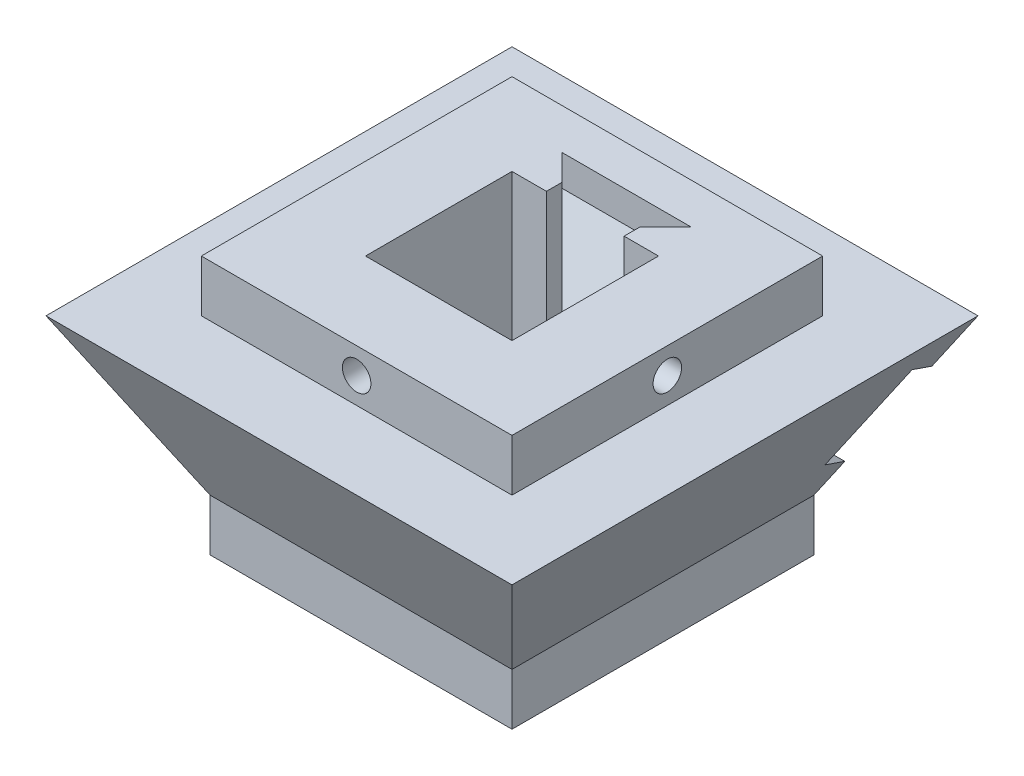
from build123d import *

# Parameters (mm, degrees)
SKETCH1_W                = 58.3
SKETCH1_H                = 58.3
SKETCH1_W_2              = 28.3
SKETCH1_H_2              = 28.3
BOSS_EXTRUDE1_DEPTH      = 10
SKETCH4_W                = 60
SKETCH4_H                = 60
BOSS_EXTRUDE2_DEPTH      = 10
SKETCH6_W                = 60
SKETCH6_H                = 26.8
ESP32_DEPTH              = 6
SKETCH8_W                = 28.3
SKETCH8_H                = 28.3
CUT_EXTRUDE3_DEPTH       = 48
SKETCH10_W               = 30
SKETCH10_H               = 5
CUT_EXTRUDE5_DEPTH       = 50
CUT_EXTRUDE2_REACH       = 95.195
SKETCH7_W                = 50
SKETCH7_H                = 3.2
CUT_EXTRUDE6_START       = -10
CUT_EXTRUDE6_DEPTH       = 71.932070392
CUT_EXTRUDE7_START       = -25
CUT_EXTRUDE7_DEPTH       = 50
CUT_EXTRUDE8_REACH       = 102.747
SKETCH14_W               = 15
SKETCH14_H               = 3
CUT_EXTRUDE9_DEPTH       = 48
CHAMFER1_SIZE            = 7.5
CUT_EXTRUDE10_REACH      = 81.712
SKETCH15_R               = 2.65
SKETCH16_W               = 15.4
SKETCH16_H               = 16.6
CANBUS_DEPTH             = 3
SKETCH18_R               = 1.35
M2_CANBUS_HEAT_SET_DEPTH = 6
SKETCH19_R               = 2.75
CUT_EXTRUDE13_DEPTH      = 8
SKETCH20_R               = 2.75
CUT_EXTRUDE14_DEPTH      = 8
SKETCH21_R               = 2.75
CUT_EXTRUDE15_DEPTH      = 8
CUT_EXTRUDE16_START      = -8
SKETCH22_R               = 2.75
CUT_EXTRUDE16_DEPTH      = 8


# Read off the part's stored shape, not the designer's step: Cut-Extrude7
with BuildPart() as part:
    # Sketch1 → Boss-Extrude1 (new body)
    # profile 1 of 2: a face of its own
    with BuildSketch(Plane(origin=(0, 0, 0), x_dir=(1, 0, 0), z_dir=(0, 1, 0))):
        Rectangle(SKETCH1_W, SKETCH1_H)
        Rectangle(SKETCH1_W_2, SKETCH1_H_2, mode=Mode.SUBTRACT)
    # profile 2 of 2: a face of its own
    with BuildSketch(Plane(origin=(0, 0, 0), x_dir=(1, 0, 0), z_dir=(0, 1, 0))):
        Rectangle(SKETCH1_W_2, SKETCH1_H_2)
    extrude(amount=BOSS_EXTRUDE1_DEPTH)

    # Sketch2 → section 1 of loft1
    with BuildSketch(Plane(origin=(0, 40, 0), x_dir=(1, 0, 0), z_dir=(0, 1, 0)), mode=Mode.PRIVATE) as loft1_s1:
        with BuildLine():
            Line((-45, -45), (45, -45))
            Line((45, -45), (45, 45))
            Line((45, 45), (-45, 45))
            Line((-45, 45), (-45, -45))
        make_face()
    # loft from a face of the part (loft1)
    loft([part.faces().sort_by_distance((0, 10, 0))[0], loft1_s1.sketch])

    # Sketch4 → Boss-Extrude2 (add)
    with BuildSketch(Plane(origin=(0, 40, 0), x_dir=(1, 0, 0), z_dir=(0, 1, 0))):
        Rectangle(SKETCH4_W, SKETCH4_H)
    extrude(amount=BOSS_EXTRUDE2_DEPTH)

    # Sketch6 → ESP32 (cut)
    with BuildSketch(Plane(origin=(0, -9.857868483, -18.658426151), x_dir=(-1, 0, 0), z_dir=(0, -0.4671427704257183, -0.8841818998594039))):
        with Locations((0, 37.859030757)):
            Rectangle(SKETCH6_W, SKETCH6_H)
    extrude(amount=-ESP32_DEPTH, mode=Mode.SUBTRACT)

    # Sketch8 → Cut-Extrude3 (cut)
    with BuildSketch(Plane(origin=(0, 50, 0), x_dir=(1, 0, 0), z_dir=(0, 1, 0))):
        Rectangle(SKETCH8_W, SKETCH8_H)
    extrude(amount=-CUT_EXTRUDE3_DEPTH, mode=Mode.SUBTRACT)

    # Sketch10 → Cut-Extrude5 (cut)
    with BuildSketch(Plane(origin=(0, 0, 0), x_dir=(-1, 0, 0), z_dir=(0, -1, 0))):
        with Locations((0, 19.65)):
            Rectangle(SKETCH10_W, SKETCH10_H)
    extrude(amount=-CUT_EXTRUDE5_DEPTH, mode=Mode.SUBTRACT)

    # Cut-Extrude2: up to this plane
    cut_extrude2_end = Plane(origin=(-15, 50, -22.15), z_dir=(0, 0, -1))
    # Sketch7 → Cut-Extrude2 (cut, up to the surface)
    with BuildSketch(Plane(origin=(0, -7.055011861, -13.353334752), x_dir=(-1, 0, 0), z_dir=(0, -0.46714277042571845, -0.8841818998594037)), mode=Mode.PRIVATE) as cut_extrude2_sk1:
        with Locations((0, 47.659030757)):
            Rectangle(SKETCH7_W, SKETCH7_H)
    cut_extrude2_tool1 = split(extrude(cut_extrude2_sk1.sketch, amount=-CUT_EXTRUDE2_REACH, mode=Mode.PRIVATE), bisect_by=cut_extrude2_end, keep=Keep.BOTH, mode=Mode.PRIVATE)
    add(cut_extrude2_tool1.solids().sort_by_distance((0, 35.08424, -35.616906))[0], mode=Mode.SUBTRACT)
    # Sketch7 → Cut-Extrude2 (cut, up to the surface)
    with BuildSketch(Plane(origin=(0, -7.055011861, -13.353334752), x_dir=(-1, 0, 0), z_dir=(0, -0.46714277042571845, -0.8841818998594037)), mode=Mode.PRIVATE) as cut_extrude2_sk2:
        with Locations((0, 28.059030757)):
            Rectangle(SKETCH7_W, SKETCH7_H)
    cut_extrude2_tool2 = split(extrude(cut_extrude2_sk2.sketch, amount=-CUT_EXTRUDE2_REACH, mode=Mode.PRIVATE), bisect_by=cut_extrude2_end, keep=Keep.BOTH, mode=Mode.PRIVATE)
    add(cut_extrude2_tool2.solids().sort_by_distance((0, 17.754275, -26.460908))[0], mode=Mode.SUBTRACT)

    # Sketch11 → Cut-Extrude6 (cut, through all)
    with BuildSketch(Plane(origin=(0, 50, 0), x_dir=(1, 0, 0), z_dir=(0, 1, 0)).offset(CUT_EXTRUDE6_START)):
        Polygon((-25, 22.15), (25, 22.15), (15, 17.15), (-15, 17.15), align=None)
    extrude(amount=-CUT_EXTRUDE6_DEPTH, mode=Mode.SUBTRACT)

    # Cut-Extrude7 outline → Cut-Extrude7 (cut)
    with BuildSketch(Plane.YZ.offset(CUT_EXTRUDE7_START)):
        Polygon((40.38967366, -22.15), (21.841454111, -22.15), (21.504680154, -22.787427049), (36.005263311, -30.448568484), align=None)
    extrude(amount=CUT_EXTRUDE7_DEPTH, mode=Mode.SUBTRACT)

    # Cut-Extrude8: up to this plane
    cut_extrude8_end = Plane(origin=(18.658426151, -9.857868483, 0), z_dir=(-0.884181899859404, 0.4671427704257181, 0))
    # Sketch13 → Cut-Extrude8 (cut, up to the surface)
    with BuildSketch(Plane.ZY.offset(-30), mode=Mode.PRIVATE) as cut_extrude8_sk1:
        Polygon((-32.139713731, 15.658764159), (-40.548283598, 31.574038357), (-35.243192199, 34.376894979), (-26.834622332, 18.461620782), align=None)
    cut_extrude8_tool1 = split(extrude(cut_extrude8_sk1.sketch, amount=-CUT_EXTRUDE8_REACH, mode=Mode.PRIVATE), bisect_by=cut_extrude8_end, keep=Keep.BOTH, mode=Mode.PRIVATE)
    add(cut_extrude8_tool1.solids().sort_by_distance((30, 25.01783, -33.691453))[0], mode=Mode.SUBTRACT)

    # Sketch14 → Cut-Extrude9 (cut)
    with BuildSketch(Plane(origin=(0, 50, 0), x_dir=(1, 0, 0), z_dir=(0, 1, 0))):
        with Locations((0, 15.65)):
            Rectangle(SKETCH14_W, SKETCH14_H)
    extrude(amount=-CUT_EXTRUDE9_DEPTH, mode=Mode.SUBTRACT)

    # Chamfer1
    # the kernel refuses this chamfer: 7.5 mm, written as the material it adds along each edge
    with BuildSketch(Plane(origin=(15, 40, -17.15), x_dir=(-0.9996219169112968, 0, 0.02749587661058632), z_dir=(0, 1, 0))) as chamfer1_piece_1_section:
        Polygon((CHAMFER1_SIZE * 0.999621916911, -CHAMFER1_SIZE * 0.0274958766106), (-CHAMFER1_SIZE * 0.0274958766106, -CHAMFER1_SIZE * 0.999621916911), (0, 0), align=None)
    chamfer1_piece_1 = extrude(amount=10, mode=Mode.PRIVATE)
    chamfer1_piece_1 = split(chamfer1_piece_1, bisect_by=Plane(origin=(12.200765376, 42.822931518, -22.15), z_dir=(0, 0, 1)), keep=Keep.TOP, mode=Mode.PRIVATE)
    add(chamfer1_piece_1)
    with BuildSketch(Plane(origin=(-15, 40, -17.15), x_dir=(0.9996219169112968, 0, 0.02749587661058632), z_dir=(0, 1, 0))) as chamfer1_piece_2_section:
        Polygon((CHAMFER1_SIZE * 0.999621916911, CHAMFER1_SIZE * 0.0274958766106), (-CHAMFER1_SIZE * 0.0274958766106, CHAMFER1_SIZE * 0.999621916911), (0, 0), align=None)
    chamfer1_piece_2 = extrude(amount=10, mode=Mode.PRIVATE)
    chamfer1_piece_2 = split(chamfer1_piece_2, bisect_by=Plane(origin=(-12.200765376, 42.822931518, -22.15), z_dir=(0, 0, 1)), keep=Keep.TOP, mode=Mode.PRIVATE)
    add(chamfer1_piece_2)

    # Sketch15 → Cut-Extrude10 (cut, up to next)
    with BuildSketch(Plane(origin=(0, 2, 0), x_dir=(1, 0, 0), z_dir=(0, 1, 0)), mode=Mode.PRIVATE) as cut_extrude10_sk1:
        with Locations(Location((0, 0, 0), (0, 0, 270))):
            Circle(SKETCH15_R)
    cut_extrude10_tool1 = extrude(cut_extrude10_sk1.sketch, amount=-CUT_EXTRUDE10_REACH, mode=Mode.PRIVATE) & part.part
    add(cut_extrude10_tool1.solids().sort_by_distance((0, 2, 0))[0], mode=Mode.SUBTRACT)

    # Sketch16 → CANbus (cut)
    with BuildSketch(Plane(origin=(-18.658426151, -9.857868483, 0), x_dir=(0, 0, 1), z_dir=(-0.8841818998594037, -0.46714277042571845, 0))):
        with Locations((0, 40.759030757)):
            Rectangle(SKETCH16_W, SKETCH16_H)
    extrude(amount=-CANBUS_DEPTH, mode=Mode.SUBTRACT)

    # Sketch18 → M2-CANbus-Heat-Set (cut)
    with BuildSketch(Plane(origin=(-16.005880452, -8.456440172, 0), x_dir=(0, 0, 1), z_dir=(-0.8841818998594035, -0.46714277042571867, 0))):
        with Locations(Location((5.2, 45.898343703, 0), (0, 0, 270))):
            Circle(SKETCH18_R)
        with Locations(Location((5.2, 34.898343703, 0), (0, 0, 270))):
            Circle(SKETCH18_R)
    extrude(amount=-M2_CANBUS_HEAT_SET_DEPTH, mode=Mode.SUBTRACT)

    # Sketch19 → Cut-Extrude13 (cut)
    with BuildSketch(Plane(origin=(0, 0, -30), x_dir=(-1, 0, 0), z_dir=(0, 0, -1))):
        with Locations((-22.5, 45)):
            Circle(SKETCH19_R)
        with Locations((22.5, 45)):
            Circle(SKETCH19_R)
    extrude(amount=-CUT_EXTRUDE13_DEPTH, mode=Mode.SUBTRACT)

    # Sketch20 → Cut-Extrude14 (cut)
    with BuildSketch(Plane(origin=(30, 0, 0), x_dir=(0, 0, -1), z_dir=(1, 0, 0))):
        with Locations((0, 45)):
            Circle(SKETCH20_R)
    extrude(amount=-CUT_EXTRUDE14_DEPTH, mode=Mode.SUBTRACT)

    # Sketch21 → Cut-Extrude15 (cut)
    with BuildSketch(Plane.XY.offset(30)):
        with Locations((0, 45)):
            Circle(SKETCH21_R)
    extrude(amount=-CUT_EXTRUDE15_DEPTH, mode=Mode.SUBTRACT)

    # Sketch22 → Cut-Extrude16 (cut)
    with BuildSketch(Plane.ZY.offset(30).offset(CUT_EXTRUDE16_START)):
        with Locations(Location((0, 45, 0), (0, 0, 180))):
            Circle(SKETCH22_R)
    extrude(amount=CUT_EXTRUDE16_DEPTH, mode=Mode.SUBTRACT)


solid = part.part
